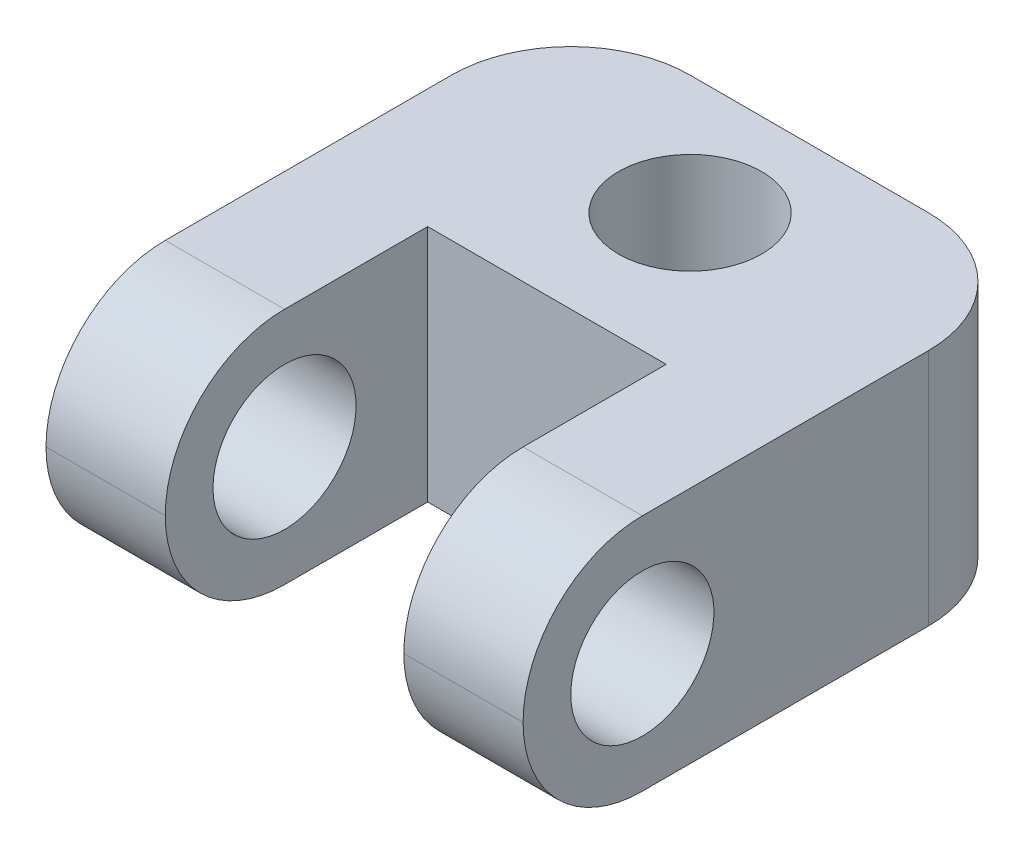
from build123d import *

# Parameters (mm, degrees)
SKETCH1_W           = 10
SKETCH1_H           = 11
BOSS_EXTRUDE1_DEPTH = 5
SKETCH3_W           = 5
SKETCH3_H           = 5.5
CUT_EXTRUDE1_DEPTH  = 5
SKETCH4_R           = 1.5
CUT_EXTRUDE2_DEPTH  = 5
SKETCH5_R           = 1.5
CUT_EXTRUDE3_DEPTH  = 10
FILLET1_R           = 2.5
FILLET2_R           = 2.5


with BuildPart() as part:
    # Sketch1 → Boss-Extrude1 (new body)
    with BuildSketch(Plane(origin=(0, 0, 0), x_dir=(1, 0, 0), z_dir=(0, 1, 0))):
        Rectangle(SKETCH1_W, SKETCH1_H)
    extrude(amount=BOSS_EXTRUDE1_DEPTH)

    # Sketch3 → Cut-Extrude1 (cut)
    with BuildSketch(Plane(origin=(0, 5, 0), x_dir=(1, 0, 0), z_dir=(0, 1, 0))):
        with Locations((0, -2.75)):
            Rectangle(SKETCH3_W, SKETCH3_H)
    extrude(amount=-CUT_EXTRUDE1_DEPTH, mode=Mode.SUBTRACT)

    # Sketch4 → Cut-Extrude2 (cut)
    with BuildSketch(Plane(origin=(0, 5, 0), x_dir=(1, 0, 0), z_dir=(0, 1, 0))):
        with Locations(Location((0, 3, 0), (0, 0, 270))):
            Circle(SKETCH4_R)
    extrude(amount=-CUT_EXTRUDE2_DEPTH, mode=Mode.SUBTRACT)

    # Sketch5 → Cut-Extrude3 (cut)
    with BuildSketch(Plane.ZY.offset(5)):
        with Locations((3, 2.5)):
            Circle(SKETCH5_R)
    extrude(amount=-CUT_EXTRUDE3_DEPTH, mode=Mode.SUBTRACT)

    # Fillet1
    fillet1_edges = [part.edges().sort_by_distance(p)[0] for p in [
        (3.75, 0, 5.5),
        (3.75, 5, 5.5),
        (-3.75, 0, 5.5),
        (-3.75, 5, 5.5),
    ]]
    fillet(fillet1_edges, radius=FILLET1_R - 0.0001)  # a hair under: the kernel refuses the full size

    # Fillet2
    fillet2_edges = [part.edges().sort_by_distance(p)[0] for p in [
        (-5, 2.5, -5.5),
        (5, 2.5, -5.5),
    ]]
    fillet(fillet2_edges, radius=FILLET2_R)


solid = part.part
